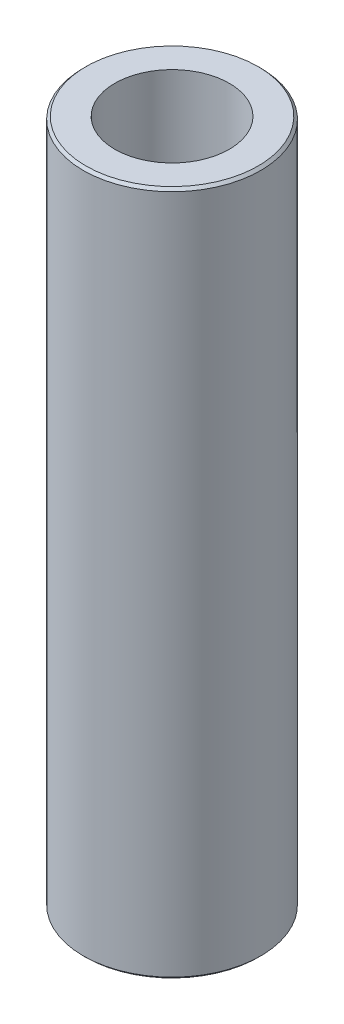
from build123d import *
from OCP.BRepFilletAPI import BRepFilletAPI_MakeChamfer

# Parameters (mm, degrees)
SKETCH1_R           = 15
BOSS_EXTRUDE1_DEPTH = 115.91655837
SKETCH2_R           = 9.680201695
CUT_EXTRUDE1_DEPTH  = 118.841624667
CHAMFER1_SIZE       = 0.444913807
CHAMFER1_SIZE2      = 0.436372823


with BuildPart() as part:
    # Sketch1 → Boss-Extrude1 (new body)
    with BuildSketch(Plane(origin=(0, 0, 0), x_dir=(1, 0, 0), z_dir=(0, 1, 0))):
        Circle(SKETCH1_R)
    extrude(amount=BOSS_EXTRUDE1_DEPTH)

    # Sketch2 → Cut-Extrude1 (cut, through all)
    with BuildSketch(Plane(origin=(0, 0, 0), x_dir=(1, 0, 0), z_dir=(0, 1, 0))):
        Circle(SKETCH2_R)
    extrude(amount=CUT_EXTRUDE1_DEPTH, mode=Mode.SUBTRACT)

    # Chamfer1: one chamfer whose edges measure the first distance from different faces: ONE call of the kernel's chamfer builder (chamfer() names one face for all edges)
    chamfer1_edges_1 = [part.edges().sort_by_distance(p)[0] for p in [
        (-15, 115.91655837, 0),
    ]]
    chamfer1_side_1 = [part.faces().sort_by_distance(p)[0] for p in [
        (-15, 57.958279185, 0),
    ]]
    chamfer1_edges_2 = [part.edges().sort_by_distance(p)[0] for p in [
        (-15, 0, 0),
    ]]
    chamfer1_side_2 = [part.faces().sort_by_distance(p)[0] for p in [
        (-14.575735931, 0, 0),
    ]]
    chamfer1 = BRepFilletAPI_MakeChamfer(part.part.solid().wrapped)
    for e in chamfer1_edges_1:
        chamfer1.Add(CHAMFER1_SIZE, CHAMFER1_SIZE2, e.wrapped, chamfer1_side_1[0].wrapped)  # the first distance lies on this face
    for e in chamfer1_edges_2:
        chamfer1.Add(CHAMFER1_SIZE, CHAMFER1_SIZE2, e.wrapped, chamfer1_side_2[0].wrapped)  # the first distance lies on this face
    add(Compound.cast(chamfer1.Shape()), mode=Mode.REPLACE)


solid = part.part
